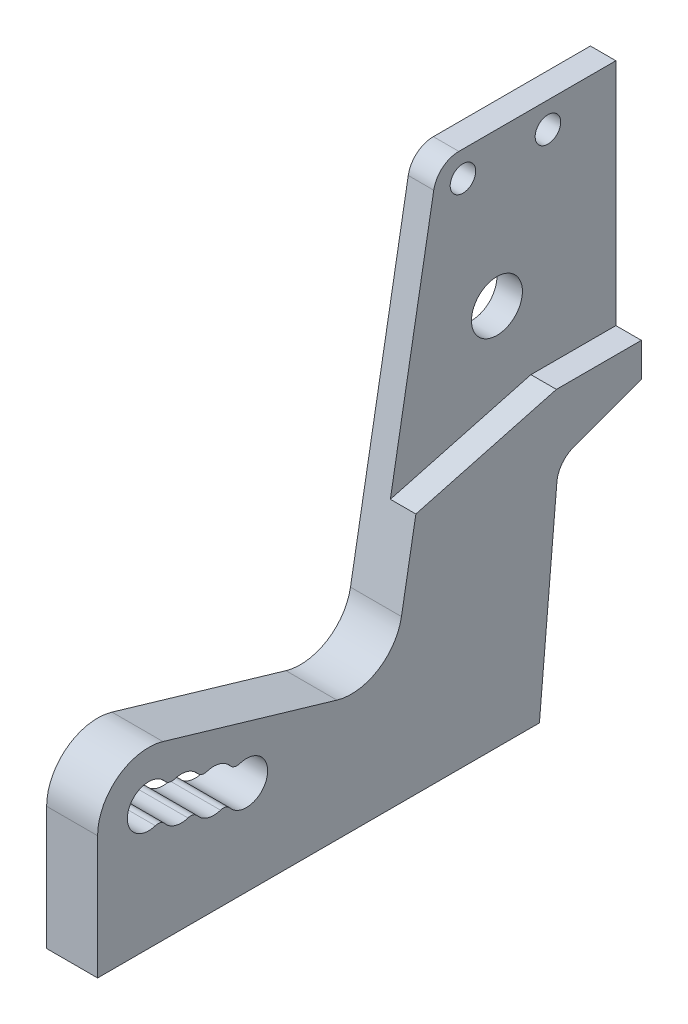
from build123d import *

# Parameters (mm, degrees)
SKETCH1_W                   = 64
SKETCH1_H                   = 60
SKETCH1_R                   = 2.5
SKETCH1_R_2                 = 3
BOSS_EXTRUDE1_DEPTH         = 6
CUT_EXTRUDE2_REACH          = 89.932
FILLET2_R                   = 3
TAP_DRILL_FOR_M3_TAP1_D     = 2.5
TAP_DRILL_FOR_M3_TAP1_DEPTH = 9
TAP_DRILL_FOR_M3_TAP1_TIP   = 0.751075774
CUT_EXTRUDE3_DEPTH          = 8
CUT_EXTRUDE4_DEPTH          = 3
FILLET3_R                   = 3
CUT_EXTRUDE5_REACH          = 89.778
SKETCH14_R                  = 1.5
CUT_EXTRUDE6_REACH          = 89.932
SKETCH15_R                  = 2.5
LPATTERN3_COUNT             = 3
LPATTERN3_PITCH             = 4
FILLET4_R                   = 1


with BuildPart() as part:
    # Sketch1 → Boss-Extrude1 (new body)
    with BuildSketch(Plane(origin=(0, 0, 0), x_dir=(0, 0, -1), z_dir=(1, 0, 0))):
        with Locations((32, 30)):
            Rectangle(SKETCH1_W, SKETCH1_H)
        with Locations((6, 14.5)):
            Circle(SKETCH1_R, mode=Mode.SUBTRACT)
        with Locations((50, 42)):
            Circle(SKETCH1_R_2, mode=Mode.SUBTRACT)
    extrude(amount=BOSS_EXTRUDE1_DEPTH)

    # Sketch3 → Cut-Extrude2 (cut, up to next)
    with BuildSketch(Plane(origin=(6, 0, 0), x_dir=(0, 0, -1), z_dir=(1, 0, 0)), mode=Mode.PRIVATE) as cut_extrude2_sk1:
        Polygon((64, 0), (52, 0), (54.225932994, 25.442530542), (64, 29), align=None)
    cut_extrude2_tool1 = extrude(cut_extrude2_sk1.sketch, amount=-CUT_EXTRUDE2_REACH, mode=Mode.PRIVATE) & part.part
    add(cut_extrude2_tool1.solids().sort_by_distance((6, 13.1347, -58.667711))[0], mode=Mode.SUBTRACT)

    # Fillet2
    fillet2_edges = [part.edges().sort_by_distance(p)[0] for p in [
        (3, 25.442530542, -54.225932994),
    ]]
    fillet(fillet2_edges, radius=FILLET2_R)

    # Tap Drill for M3 Tap1
    with Locations(Plane(origin=(0, 0, 0), x_dir=(-1, 0, 0), z_dir=(0, -1, 0))):
        with Locations((-3, 46), (-3, 10)):
            Hole(TAP_DRILL_FOR_M3_TAP1_D / 2, depth=TAP_DRILL_FOR_M3_TAP1_DEPTH)
            with Locations((0, 0, -(TAP_DRILL_FOR_M3_TAP1_DEPTH + TAP_DRILL_FOR_M3_TAP1_TIP / 2))):  # 118° drill point
                Cone(0, TAP_DRILL_FOR_M3_TAP1_D / 2, TAP_DRILL_FOR_M3_TAP1_TIP, mode=Mode.SUBTRACT)

    # Sketch9 → Cut-Extrude3 (cut)
    with BuildSketch(Plane(origin=(6, 0, 0), x_dir=(0, 0, -1), z_dir=(1, 0, 0))):
        with BuildLine():
            Line((7.690999277, 20.256780476), (28.163361823, 14.243219524))
            ThreePointArc((28.163361823, 14.243219524), (33.017446475, 14.901481498), (35.763207618, 18.958110934))
            Line((35.763207618, 18.958110934), (43, 60))
            Line((43, 60), (0, 60))
            Line((0, 60), (0, 14.5))
            ThreePointArc((0, 14.5), (2.404585953, 19.303436044), (7.690999277, 20.256780476))
        make_face()
    extrude(amount=-CUT_EXTRUDE3_DEPTH, mode=Mode.SUBTRACT)

    # Sketch13 → Cut-Extrude4 (cut)
    with BuildSketch(Plane(origin=(6, 0, 0), x_dir=(0, 0, -1), z_dir=(1, 0, 0))):
        Polygon((54, 33), (64, 33), (64, 60), (43, 60), (37.457598082, 28.567476765), align=None)
    extrude(amount=-CUT_EXTRUDE4_DEPTH, mode=Mode.SUBTRACT)

    # Fillet3
    fillet3_edges = [part.edges().sort_by_distance(p)[0] for p in [
        (1.5, 60, -43),
    ]]
    fillet(fillet3_edges, radius=FILLET3_R)

    # Sketch14 → Cut-Extrude5 (cut, up to next)
    with BuildSketch(Plane(origin=(3, 0, 0), x_dir=(0, 0, -1), z_dir=(1, 0, 0)), mode=Mode.PRIVATE) as cut_extrude5_sk1:
        with Locations((56, 57)):
            Circle(SKETCH14_R)
    cut_extrude5_tool1 = extrude(cut_extrude5_sk1.sketch, amount=-CUT_EXTRUDE5_REACH, mode=Mode.PRIVATE) & part.part
    # Sketch14 → Cut-Extrude5 (cut, up to next)
    with BuildSketch(Plane(origin=(3, 0, 0), x_dir=(0, 0, -1), z_dir=(1, 0, 0)), mode=Mode.PRIVATE) as cut_extrude5_sk2:
        with Locations((46, 57)):
            Circle(SKETCH14_R)
    cut_extrude5_tool2 = extrude(cut_extrude5_sk2.sketch, amount=-CUT_EXTRUDE5_REACH, mode=Mode.PRIVATE) & part.part
    add(cut_extrude5_tool1.solids().sort_by_distance((3, 57, -56))[0], mode=Mode.SUBTRACT)
    add(cut_extrude5_tool2.solids().sort_by_distance((3, 57, -46))[0], mode=Mode.SUBTRACT)

    # Sketch15 → Cut-Extrude6 (cut, up to next)
    with BuildSketch(Plane.ZY, mode=Mode.PRIVATE) as cut_extrude6_sk1:
        with Locations((-9.83785365, 13.372667148)):
            Circle(SKETCH15_R)
    cut_extrude6_tool1 = extrude(cut_extrude6_sk1.sketch, amount=-CUT_EXTRUDE6_REACH, mode=Mode.PRIVATE) & part.part
    cut_extrude6 = cut_extrude6_tool1.solids().sort_by_distance((0, 13.372667, -9.837854))[0]
    add(cut_extrude6, mode=Mode.SUBTRACT)

    # LPattern3: Cut-Extrude6 ×3
    with Locations(*[Vector(0, -0.2818332129065459, -0.9594634125920454) * (i * LPATTERN3_PITCH) for i in range(1, LPATTERN3_COUNT)]):
        add(cut_extrude6, mode=Mode.SUBTRACT)

    # Fillet4
    fillet4_edges = [part.edges().sort_by_distance(p)[0] for p in [
        (3, 12.497138455, -7.496177006),
        (3, 11.369805604, -11.334030656),
        (3, 10.242472752, -15.171884307),
        (3, 13.12086299, -16.017383945),
        (3, 14.248195841, -12.179530295),
        (3, 15.375528693, -8.341676645),
    ]]
    fillet(fillet4_edges, radius=FILLET4_R)


solid = part.part
